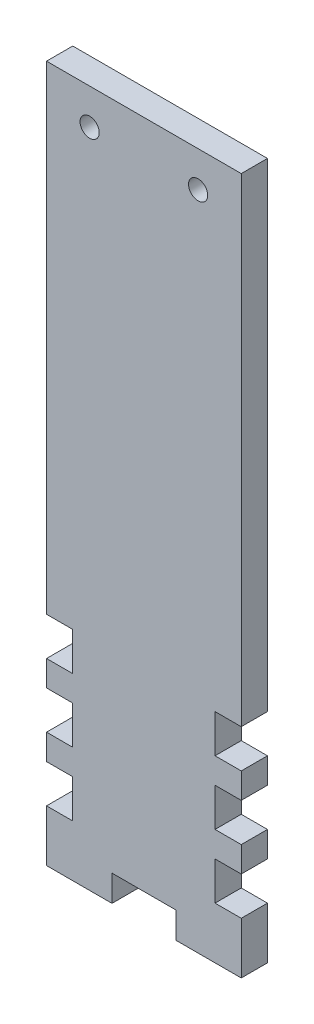
from build123d import *

# Parameters (mm, degrees)
MOTOR_SUPPORT_FRONT_PADDLE_MASTER_2_W = 30.52
MOTOR_SUPPORT_FRONT_PADDLE_MASTER_2_H = 109.191376887
MOTOR_SUPPORT_FRONT_PADDLE_MASTER_2_R = 1.5
BOSS_EXTRUDE1_DEPTH                   = 4.11
CUT_EXTRUDE1_START                    = -37.61
SKETCH14_PADDLE_MASTER_2_W            = 4.11
SKETCH14_PADDLE_MASTER_2_H            = 6
CUT_EXTRUDE1_DEPTH                    = 4.11
PADDLE_MASTER_START                   = -5
PADDLE_MASTER_OUTLINE_W               = 4.11
PADDLE_MASTER_OUTLINE_H               = 4.11
PADDLE_MASTER_DEPTH                   = 10


# Read off the part's stored shape, not the designer's step: paddle_master
with BuildPart() as part:
    # motor_support_front-paddle_master<2> → Boss-Extrude1 (new body)
    with BuildSketch(Plane(origin=(0, -2.5, 5), x_dir=(1, 0, 0), z_dir=(0, 0, 1))):
        with Locations((0, -66.737824068)):
            Rectangle(MOTOR_SUPPORT_FRONT_PADDLE_MASTER_2_W, MOTOR_SUPPORT_FRONT_PADDLE_MASTER_2_H)
        with Locations((8.5, -17.73)):
            Circle(MOTOR_SUPPORT_FRONT_PADDLE_MASTER_2_R, mode=Mode.SUBTRACT)
        with Locations((-8.5, -17.73)):
            Circle(MOTOR_SUPPORT_FRONT_PADDLE_MASTER_2_R, mode=Mode.SUBTRACT)
    extrude(amount=-BOSS_EXTRUDE1_DEPTH)

    # Sketch14-paddle_master<2> → Cut-Extrude1 (cut)
    with BuildSketch(Plane(origin=(11.15, 12.5, 38.5), x_dir=(1, 0, 0), z_dir=(0, 0, 1)).offset(CUT_EXTRUDE1_START)):
        with Locations((-24.355, -125.223512511)):
            Rectangle(SKETCH14_PADDLE_MASTER_2_W, SKETCH14_PADDLE_MASTER_2_H)
        with Locations((-24.355, -115.223512511)):
            Rectangle(SKETCH14_PADDLE_MASTER_2_W, SKETCH14_PADDLE_MASTER_2_H)
        with Locations((-24.355, -105.223512511)):
            Rectangle(SKETCH14_PADDLE_MASTER_2_W, SKETCH14_PADDLE_MASTER_2_H)
        with Locations((2.055, -125.223512511)):
            Rectangle(SKETCH14_PADDLE_MASTER_2_W, SKETCH14_PADDLE_MASTER_2_H)
        with Locations((2.055, -115.223512511)):
            Rectangle(SKETCH14_PADDLE_MASTER_2_W, SKETCH14_PADDLE_MASTER_2_H)
        with Locations((2.055, -105.223512511)):
            Rectangle(SKETCH14_PADDLE_MASTER_2_W, SKETCH14_PADDLE_MASTER_2_H)
    extrude(amount=CUT_EXTRUDE1_DEPTH, mode=Mode.SUBTRACT)

    # paddle_master outline → paddle_master (cut)
    with BuildSketch(Plane.YZ.offset(PADDLE_MASTER_START)):
        with Locations((-121.778512511, 2.945)):
            Rectangle(PADDLE_MASTER_OUTLINE_W, PADDLE_MASTER_OUTLINE_H)
    extrude(amount=PADDLE_MASTER_DEPTH, mode=Mode.SUBTRACT)


solid = part.part
